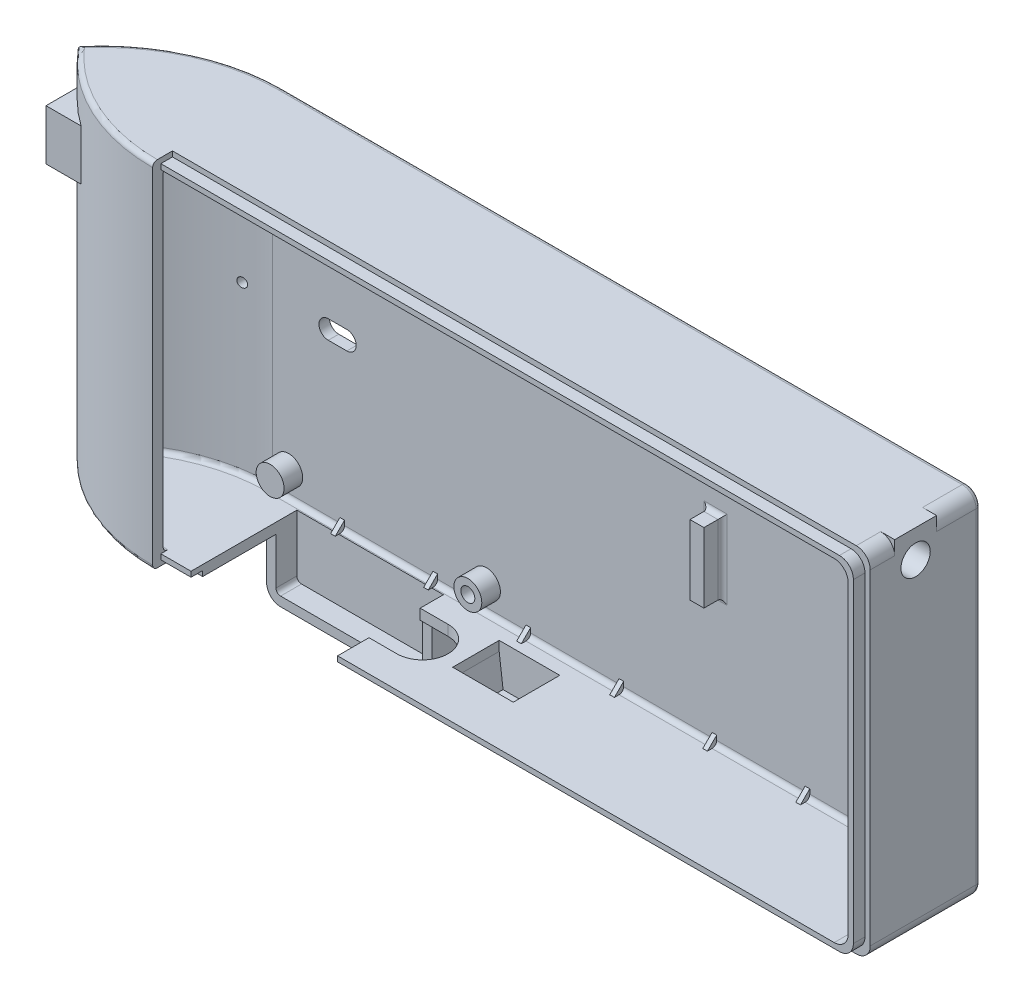
from build123d import *

# Parameters (mm, degrees)
BOSS_EXTRUDE1_DEPTH            = 38
CUT_EXTRUDE1_DEPTH             = 35.75
RIB6_REACH                     = 117.122
SKETCH4_WALL_W                 = 235.071776648
SKETCH4_WALL_H                 = 1
LPATTERN2_COUNT                = 4
LPATTERN2_PITCH                = 20
LPATTERN2_COL_COUNT            = 4
LPATTERN2_COL_PITCH            = 20
RIB8_START                     = -0.5
RIB8_DEPTH                     = 1
CLAM_SHELL_LIP_DEPTH           = 4.25
FILLET7_R                      = 3
SKETCH9_W                      = 150
SKETCH9_H                      = 76
CUT_EXTRUDE4_DEPTH             = 1.75
ARROW_SHAFT_EXTRUDE_DEPTH      = 50
SKETCH11_R                     = 3.15
ARROW_SHAFT_EX_CUT_DEPTH       = 50
SKETCH12_R                     = 3
SKETCH12_R_2                   = 1.5
PCB_STUDS_DEPTH                = 4
SHT_PCB_REACH                  = 172.47
SKETCH14_W                     = 35.5
SKETCH14_H                     = 8
PCB_EXTENSION_DEPTH            = 13
FILLET1_R                      = 3
CUT_EXTRUDE7_DEPTH             = 4.5
SKETCH16_W                     = 9.85
SKETCH16_H                     = 6.85
ANEMOMETER_SHAFT_DEPTH         = 10
SKETCH17_W                     = 13.85
SKETCH17_H                     = 10.85
SKETCH17_W_2                   = 9.85
SKETCH17_H_2                   = 6.85
ANEMOMETER_EXTRUDE_DEPTH       = 10
F_5V_BOOSTER_BELLY_DEPTH       = 10
F_5V_BOOSTER_BELLY_DEPTH_BACK  = 2
F_5V_BOOSTER_CUTOUT_DEPTH      = 9
F_5V_BOOSTER_CUTOUT_DEPTH_BACK = 1
FILLET2_R                      = 2
THERMOCOUPLE_START             = -5
THERMOCOUPLE_MOUNT_DEPTH       = 10
SKETCH23_W                     = 3
SKETCH23_H                     = 15
BATTERY_WALL_DEPTH             = 4
THERMOCOUPLE_HOLES_REACH       = 162.888
THERMOCOUPLE_HOLES_END_RADIUS  = 36.892857143
SKETCH22_R                     = 1
FILLET3_R                      = 2
FILLET4_R                      = 1


# Read off the part's stored shape, not the designer's step: Rib8, Thermocouple Mount
with BuildPart() as part:
    # Sketch1 → Boss-Extrude1 (new body)
    with BuildSketch(Plane(origin=(0, 0, 0), x_dir=(1, 0, 0), z_dir=(0, 1, 0))):
        with BuildLine():
            Line((0, 0), (150, 0))
            Line((150, 0), (150, 28))
            Line((150, 28), (0, 28))
            ThreePointArc((0, 28), (-16.552945357, 24.327740051), (-30, 14))
            ThreePointArc((-30, 14), (-16.552945357, 3.672259949), (0, 0))
        make_face()
    extrude(amount=BOSS_EXTRUDE1_DEPTH)

    # Sketch3 → Cut-Extrude1 (cut)
    with BuildSketch(Plane.XZ):
        with BuildLine():
            Line((0, -2.25), (0, 0))
            Line((0, 0), (147.75, 0))
            Line((147.75, 0), (147.75, -25.75))
            Line((147.75, -25.75), (0, -25.75))
            ThreePointArc((0, -25.75), (-14.722280248, -22.685198853), (-26.998511864, -14))
            ThreePointArc((-26.998511864, -14), (-14.722280248, -5.314801147), (0, -2.25))
        make_face()
    extrude(amount=-CUT_EXTRUDE1_DEPTH, mode=Mode.SUBTRACT)

    # Sketch4 wall → Rib6 (add, up to next)
    with BuildSketch(Plane(origin=(75, 34.75, -24.75), x_dir=(0, -0.707106781187, -0.707106781187), z_dir=(0, 0.707106781187, -0.707106781187)), mode=Mode.PRIVATE) as rib6_sk1:
        Rectangle(SKETCH4_WALL_W, SKETCH4_WALL_H)
    rib6_tool1 = extrude(rib6_sk1.sketch, amount=RIB6_REACH, mode=Mode.PRIVATE) - part.part
    rib6 = rib6_tool1.solids().sort_by_distance((75, 34.75, -24.75))[0]
    add(rib6)

    # LPattern2: Rib6 ×4
    with Locations(*[(-i * LPATTERN2_PITCH, 0, 0) for i in range(1, LPATTERN2_COUNT)]):
        add(rib6)

    # LPattern2 col: Rib6 ×4
    with Locations(*[(i * LPATTERN2_COL_PITCH, 0, 0) for i in range(1, LPATTERN2_COL_COUNT)]):
        add(rib6)

    # Rib8 outline → Rib8 (add)
    with BuildSketch(Plane.XZ.offset(-20).offset(RIB8_START)):
        Polygon((147.75, -23.75), (145.75, -25.75), (147.75, -25.75), align=None)
    extrude(amount=RIB8_DEPTH)

    # Mirror1: part across plane


with BuildPart() as part_1:
    add(part.part)
    add(part.part.mirror(Plane(origin=(0, 0, -39.142857143), x_dir=(0, 0, 1), z_dir=(0, 1, 0))))

    # Sketch7 → Clam shell lip (cut)
    with BuildSketch(Plane.XY):
        Polygon((0, 38), (150, 38), (150, -38), (0, -38), (0, -36.875), (148.875, -36.875), (148.875, 36.875), (0, 36.875), align=None)
    extrude(amount=-CLAM_SHELL_LIP_DEPTH, mode=Mode.SUBTRACT)

    # Fillet7
    fillet7_edges = [part_1.edges().sort_by_distance(p)[0] for p in [
        (147.75, 35.75, -12.875),
        (147.75, -35.75, -12.875),
        (150, -38, -16.125),
        (150, 38, -16.125),
        (148.875, -36.875, -2.125),
        (148.875, 36.875, -2.125),
    ]]
    fillet(fillet7_edges, radius=FILLET7_R)

    # Sketch9 → Cut-Extrude4 (cut)
    with BuildSketch(Plane.XY):
        with Locations((75, 0)):
            Rectangle(SKETCH9_W, SKETCH9_H)
    extrude(amount=-CUT_EXTRUDE4_DEPTH, mode=Mode.SUBTRACT)

    # Sketch10 → Arrow Shaft Extrude (add)
    with BuildSketch(Plane(origin=(150, 0, 0), x_dir=(0, 0, -1), z_dir=(1, 0, 0))):
        with BuildLine():
            Line((9.5, 32), (9.5, 38))
            Line((9.5, 38), (18.5, 38))
            Line((18.5, 38), (18.5, 32))
            ThreePointArc((18.5, 32), (14, 27.5), (9.5, 32))
        make_face()
    extrude(amount=-ARROW_SHAFT_EXTRUDE_DEPTH)

    # Sketch11 → Arrow Shaft Ex-Cut (cut)
    with BuildSketch(Plane(origin=(150, 0, 0), x_dir=(0, 0, -1), z_dir=(1, 0, 0))):
        with Locations((14, 32)):
            Circle(SKETCH11_R)
    extrude(amount=-ARROW_SHAFT_EX_CUT_DEPTH, mode=Mode.SUBTRACT)

    # Sketch12 → PCB Studs (add)
    # profile 1 of 4: a face of its own
    with BuildSketch(Plane.XY.offset(-25.75)):
        with Locations(Location((46, -30.34, 0), (0, 0, 180))):
            Circle(SKETCH12_R)
        with Locations((46, -30.34)):
            Circle(SKETCH12_R_2, mode=Mode.SUBTRACT)
    # profile 2 of 4: a face of its own
    with BuildSketch(Plane.XY.offset(-25.75)):
        with Locations(Location((3.5, 19.66, 0), (0, 0, 180))):
            Circle(SKETCH12_R)
        with Locations((3.5, 19.66)):
            Circle(SKETCH12_R_2, mode=Mode.SUBTRACT)
    # profile 3 of 4: a face of its own
    with BuildSketch(Plane.XY.offset(-25.75)):
        with Locations(Location((3.5, -30.34, 0), (0, 0, 180))):
            Circle(SKETCH12_R)
    # profile 4 of 4: a face of its own
    with BuildSketch(Plane.XY.offset(-25.75)):
        with Locations(Location((78.5, 19.66, 0), (0, 0, 180))):
            Circle(SKETCH12_R)
    extrude(amount=PCB_STUDS_DEPTH)

    # SHT-PCB: up to this face of the body (flat: up to its plane)
    sht_pcb_end = Plane(part_1.part.faces().sort_by_distance((63.055589746, -35.75, -13.738623539))[0])
    # Sketch13 → SHT-PCB (cut, up to the picked face)
    with BuildSketch(Plane.XZ.offset(38), mode=Mode.PRIVATE) as sht_pcb_sk1:
        with BuildLine():
            Line((6.5, -1.75), (38, -1.75))
            Line((38, -1.75), (38, -8.5))
            Line((38, -8.5), (44, -8.5))
            ThreePointArc((44, -8.5), (49.5, -14), (44, -19.5))
            Line((44, -19.5), (38, -19.5))
            Line((38, -19.5), (38, -24.5))
            Line((38, -24.5), (6.5, -24.5))
            Line((6.5, -24.5), (6.5, -1.75))
        make_face()
    sht_pcb_tool1 = split(extrude(sht_pcb_sk1.sketch, amount=-SHT_PCB_REACH, mode=Mode.PRIVATE), bisect_by=sht_pcb_end, keep=Keep.BOTH, mode=Mode.PRIVATE)
    add(sht_pcb_tool1.solids().sort_by(Axis((25.119273, -38, -13.244651), (0, 1, 0)))[0], mode=Mode.SUBTRACT)

    # Sketch14 → PCB extension (add)
    with BuildSketch(Plane.XZ.offset(38)):
        with Locations((22.25, -24)):
            Rectangle(SKETCH14_W, SKETCH14_H)
    extrude(amount=PCB_EXTENSION_DEPTH)

    # Fillet1
    fillet1_edges = [part_1.edges().sort_by_distance(p)[0] for p in [
        (4.5, -51, -24),
        (40, -51, -24),
    ]]
    fillet(fillet1_edges, radius=FILLET1_R)

    # Sketch15 → Cut-Extrude7 (cut)
    with BuildSketch(Plane.XY.offset(-20)):
        with BuildLine():
            Line((6.5, -40), (6.5, -38))
            Line((6.5, -38), (38, -38))
            Line((38, -38), (38, -40))
            Line((38, -40), (38, -48))
            ThreePointArc((38, -48), (37.707106781, -48.707106781), (37, -49))
            Line((37, -49), (7.5, -49))
            ThreePointArc((7.5, -49), (6.792893219, -48.707106781), (6.5, -48))
            Line((6.5, -48), (6.5, -40))
        make_face()
    extrude(amount=-CUT_EXTRUDE7_DEPTH, mode=Mode.SUBTRACT)

    # Sketch16 → Anemometer Shaft (cut)
    with BuildSketch(Plane(origin=(-30, 0, 0), x_dir=(0, 0, -1), z_dir=(1, 0, 0))):
        with Locations((14, 24.575)):
            Rectangle(SKETCH16_W, SKETCH16_H)
    extrude(amount=ANEMOMETER_SHAFT_DEPTH, mode=Mode.SUBTRACT)

    # Sketch17 → Anemometer Extrude (add)
    with BuildSketch(Plane(origin=(-30, 0, 0), x_dir=(0, 0, -1), z_dir=(1, 0, 0))):
        with Locations((14, 24.575)):
            Rectangle(SKETCH17_W, SKETCH17_H)
        with Locations((14, 24.575)):
            Rectangle(SKETCH17_W_2, SKETCH17_H_2, mode=Mode.SUBTRACT)
    extrude(amount=ANEMOMETER_EXTRUDE_DEPTH)

    # Sketch19 → 5V booster belly (add, two sides: drawn at the far end of the back side and taken through both)
    with BuildSketch(Plane(origin=(0, 0, -13), x_dir=(-1, 0, 0), z_dir=(0, 0, -1)).offset(-F_5V_BOOSTER_BELLY_DEPTH_BACK)):
        Polygon((-51, -38), (-52, -46), (-66, -46), (-67, -38), align=None)
    extrude(amount=F_5V_BOOSTER_BELLY_DEPTH + F_5V_BOOSTER_BELLY_DEPTH_BACK)

    # Sketch20 → 5V booster cutout (cut, two sides: drawn at the far end of the back side and taken through both)
    with BuildSketch(Plane(origin=(0, 0, -13), x_dir=(-1, 0, 0), z_dir=(0, 0, -1)).offset(-F_5V_BOOSTER_CUTOUT_DEPTH_BACK)):
        Polygon((-65.511583185, -37.813947898), (-65.511583185, -32.813947898), (-52.488416815, -32.813947898), (-52.488416815, -37.813947898), (-53.324173328, -44.5), (-64.675826672, -44.5), align=None)
    extrude(amount=F_5V_BOOSTER_CUTOUT_DEPTH + F_5V_BOOSTER_CUTOUT_DEPTH_BACK, mode=Mode.SUBTRACT)

    # Fillet2
    fillet2_edges = [part_1.edges().sort_by_distance(p)[0] for p in [
        (51.5, -42, -11),
        (52, -46, -17),
        (59, -46, -11),
        (66, -46, -17),
        (66.5, -42, -11),
        (66.5, -42, -23),
        (59, -46, -23),
        (51.5, -42, -23),
    ]]
    fillet(fillet2_edges, radius=FILLET2_R)

    # Thermocouple Mount outline → Thermocouple Mount (add)
    with BuildSketch(Plane(origin=(0, 0, 0), x_dir=(1, 0, 0), z_dir=(0, 1, 0)).offset(THERMOCOUPLE_START)):
        with BuildLine():
            Line((0, 28), (-30, 28))
            Line((-30, 28), (-30, 14))
            ThreePointArc((-30, 14), (-16.552945357, 24.327740051), (0, 28))
        make_face()
    extrude(amount=THERMOCOUPLE_MOUNT_DEPTH)

    # Sketch23 → Battery Wall (add)
    with BuildSketch(Plane.XY.offset(-25.75)):
        with Locations((95.25, 0)):
            Rectangle(SKETCH23_W, SKETCH23_H)
    extrude(amount=BATTERY_WALL_DEPTH)

    # Thermocouple Holes: up to this cylinder (the profile starts outside it)
    thermocouple_holes_end = Plane(origin=(0, 0, 11.142857143), z_dir=(0, -1, 0)) * Cylinder(THERMOCOUPLE_HOLES_END_RADIUS, 400.561714286, mode=Mode.PRIVATE)
    # Sketch22 → Thermocouple Holes (cut, up to the surface)
    with BuildSketch(Plane(origin=(0, 0, -28), x_dir=(-1, 0, 0), z_dir=(0, 0, -1)), mode=Mode.PRIVATE) as thermocouple_holes_sk1:
        with Locations((6, 0)):
            Circle(SKETCH22_R)
    thermocouple_holes_tool1 = extrude(thermocouple_holes_sk1.sketch, amount=-THERMOCOUPLE_HOLES_REACH, mode=Mode.PRIVATE) - thermocouple_holes_end
    add(thermocouple_holes_tool1.solids().sort_by_distance((-6, 0, -28))[0], mode=Mode.SUBTRACT)
    # Sketch22 → Thermocouple Holes (cut, up to the surface)
    with BuildSketch(Plane(origin=(0, 0, -28), x_dir=(-1, 0, 0), z_dir=(0, 0, -1)), mode=Mode.PRIVATE) as thermocouple_holes_sk2:
        with BuildLine():
            Line((-12, -2), (-16, -2))
            ThreePointArc((-16, -2), (-18, 0), (-16, 2))
            Line((-16, 2), (-12, 2))
            ThreePointArc((-12, 2), (-10, 0), (-12, -2))
        make_face()
    thermocouple_holes_tool2 = extrude(thermocouple_holes_sk2.sketch, amount=-THERMOCOUPLE_HOLES_REACH, mode=Mode.PRIVATE) - thermocouple_holes_end
    add(thermocouple_holes_tool2.solids().sort_by_distance((14, 0, -28))[0], mode=Mode.SUBTRACT)

    # Fillet3
    # the kernel refuses this fillet: 2 mm, written as the material it adds along each edge
    with BuildSketch(Plane(origin=(1e-09, -5, 11.142857146), x_dir=(-0.8420148591258426, 0, -0.5394543326466915), z_dir=(-0.5394543326466915, 0, 0.8420148591258426))) as fillet3_piece_1_section:
        with BuildLine():
            CenterArc((39.142857146 + FILLET3_R, FILLET3_R), FILLET3_R, 180, 90)
            Line((39.142857146 + FILLET3_R, 0), (39.142857146, 0))
            Line((39.142857146, 0), (39.142857146, FILLET3_R))
        make_face()
    fillet3_piece_1 = revolve(axis=Axis((1e-09, -5, 11.142857146), (0, -1, 0)), revolution_arc=64.673211788, mode=Mode.PRIVATE)
    fillet3_piece_1 = split(fillet3_piece_1, bisect_by=Plane(origin=(-16.791968908, -5.56522054, -28), z_dir=(0, 0, 1)), keep=Keep.TOP, mode=Mode.PRIVATE)
    fillet3_piece_1 = split(fillet3_piece_1, bisect_by=Plane(origin=(-30, -5.56522054, -24.839933375), z_dir=(1, 0, 0)), keep=Keep.TOP, mode=Mode.PRIVATE)
    add(fillet3_piece_1)
    with BuildSketch(Plane(origin=(1e-09, 5, 11.142857146), x_dir=(-0.8420148591258426, 0, -0.5394543326466915), z_dir=(-0.5394543326466915, 0, 0.8420148591258426))) as fillet3_piece_2_section:
        with BuildLine():
            CenterArc((39.142857146 + FILLET3_R, -FILLET3_R), FILLET3_R, 90, 90)
            Line((39.142857146, -FILLET3_R), (39.142857146, 0))
            Line((39.142857146, 0), (39.142857146 + FILLET3_R, 0))
        make_face()
    fillet3_piece_2 = revolve(axis=Axis((1e-09, 5, 11.142857146), (0, -1, 0)), revolution_arc=64.673211788, mode=Mode.PRIVATE)
    fillet3_piece_2 = split(fillet3_piece_2, bisect_by=Plane(origin=(-16.791968906, 5.56522054, -28), z_dir=(0, 0, 1)), keep=Keep.TOP, mode=Mode.PRIVATE)
    fillet3_piece_2 = split(fillet3_piece_2, bisect_by=Plane(origin=(-30, 5.56522054, -24.839933375), z_dir=(1, 0, 0)), keep=Keep.TOP, mode=Mode.PRIVATE)
    add(fillet3_piece_2)

    # Fillet4
    fillet4_edges = [part_1.edges().sort_by_distance(p)[0] for p in [
        (65, 35.75, -25.75),
        (45, 35.75, -25.75),
        (25, 35.75, -25.75),
        (147.75, 0, -25.75),
        (7.25, 35.75, -25.75),
        (-16.552945357, 38, -24.327740051),
        (-14.722280248, 35.75, -22.685198853),
        (-14.722280248, 35.75, -5.314801147),
        (-16.552945357, -38, -3.672259949),
        (-16.552945357, -38, -24.327740051),
        (7.25, -35.75, -25.75),
        (25, -35.75, -25.75),
        (45, -35.75, -25.75),
        (65, -35.75, -25.75),
        (85, -35.75, -25.75),
        (105, -35.75, -25.75),
        (125, -35.75, -25.75),
        (140.125, -35.75, -25.75),
        (-14.722280248, -35.75, -22.685198853),
        (-14.722280248, -35.75, -5.314801147),
        (73.5, 38, -28),
        (150, 0, -28),
        (93.5, -38, -28),
        (149.121320344, -37.121320344, -28),
        (149.121320344, 37.121320344, -28),
        (147.75, -26.625, -25.75),
        (147.75, 26.625, -25.75),
        (146.871320344, 34.871320344, -25.75),
        (146.871320344, -34.871320344, -25.75),
        (85, 35.75, -25.75),
        (122.375, 35.75, -9.5),
        (146.871320344, 34.871320344, -9.5),
        (147.75, 32.375, -9.5),
        (122.375, 35.75, -18.5),
        (147.75, 32.375, -18.5),
        (146.871320344, 34.871320344, -18.5),
        (147.75, 27.5, -14),
        (2.25, -38, -28),
        (-16.552945357, 38, -3.672259949),
        (22.25, -51, -28),
        (40, -43, -28),
        (4.5, -43, -28),
        (5.378679656, -50.121320344, -28),
        (39.121320344, -50.121320344, -28),
        (105, 35.75, -25.75),
        (93.75, 0, -25.75),
        (95.25, -7.5, -25.75),
        (96.75, 0, -25.75),
        (95.25, 7.5, -25.75),
        (125, 35.75, -25.75),
        (140.125, 35.75, -25.75),
    ]]
    fillet(fillet4_edges, radius=FILLET4_R)


solid = part_1.part
